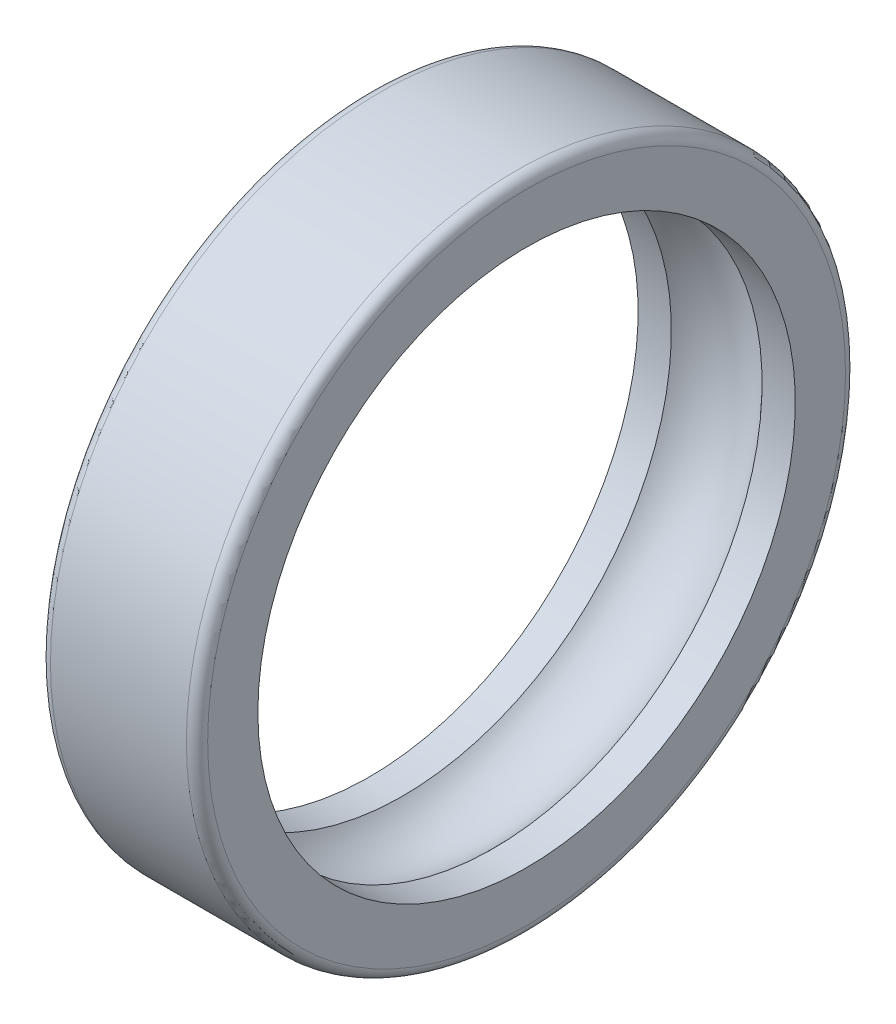
from build123d import *

# Parameters (mm, degrees)
FILLET1_R    = 2.1
SCALE1_SCALE = 0.07


with BuildPart() as part:
    # Sketch1 → Revolve1 (revolve)
    with BuildSketch(Plane.XY):
        with BuildLine():
            Line((-15.5, 65), (15.5, 65))
            Line((15.5, 65), (15.5, 53))
            Line((15.5, 53), (8.94427191, 53))
            ThreePointArc((8.94427191, 53), (0, 57), (-8.94427191, 53))
            Line((-8.94427191, 53), (-15.5, 53))
            Line((-15.5, 53), (-15.5, 65))
        make_face()
    revolve(axis=Axis((-25.358454362, 0, 0), (1, 0, 0)))

    # Fillet1
    fillet1_edges = [part.edges().sort_by_distance(p)[0] for p in [
        (15.5, -65, 0),
        (-15.5, -65, 0),
    ]]
    fillet(fillet1_edges, radius=FILLET1_R)


with BuildPart() as part_1:
    # Scale1: scaled about (0, 0, 0)
    add(part.part.scale(SCALE1_SCALE))


solid = part_1.part
